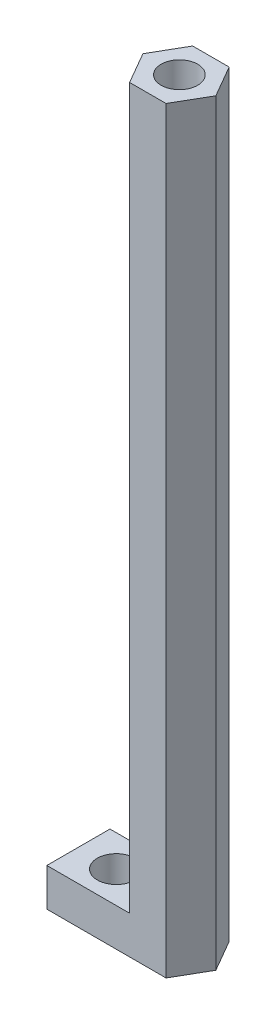
from build123d import *

# Parameters (mm, degrees)
SKETCH2_R           = 1.5
BOSS_EXTRUDE1_DEPTH = 3
BOSS_EXTRUDE2_DEPTH = 60
SKETCH3_R           = 1.45
CUT_EXTRUDE1_DEPTH  = 10
CUT_EXTRUDE2_DEPTH  = 8
SKETCH5_R           = 2.5
CUT_EXTRUDE3_DEPTH  = 3
CHAMFER1_SIZE       = 1


with BuildPart() as part:
    # Sketch2 → Boss-Extrude1 (new body)
    # profile 1 of 3: a face of its own
    with BuildSketch(Plane(origin=(0, 0, 0), x_dir=(1, 0, 0), z_dir=(0, 1, 0))):
        Polygon((2.113248654, 0), (3.556624327, 2.5), (-3, 2.5), (-3, -2.5), (3.556624327, -2.5), align=None)
        with Locations(Location((0, 0, 0), (0, 0, 270))):
            Circle(SKETCH2_R, mode=Mode.SUBTRACT)
    # profile 2 of 3: a face of its own
    with BuildSketch(Plane(origin=(0, 0, 0), x_dir=(1, 0, 0), z_dir=(0, 1, 0))):
        Polygon((8, -2.5), (8, 2.5), (6.443375673, 2.5), (7.886751346, 0), (6.443375673, -2.5), align=None)
    # profile 3 of 3: a face of its own
    with BuildSketch(Plane(origin=(0, 0, 0), x_dir=(1, 0, 0), z_dir=(0, 1, 0))):
        Polygon((7.886751346, 0), (6.443375673, 2.5), (3.556624327, 2.5), (2.113248654, 0), (3.556624327, -2.5), (6.443375673, -2.5), align=None)
    extrude(amount=BOSS_EXTRUDE1_DEPTH)

    # Sketch2<3> → Boss-Extrude2 (add)
    with BuildSketch(Plane(origin=(0, 0, 0), x_dir=(1, 0, 0), z_dir=(0, 1, 0))):
        Polygon((3.556624327, 2.5), (2.113248654, 0), (3.556624327, -2.5), (6.443375673, -2.5), (7.886751346, 0), (6.443375673, 2.5), align=None)
    extrude(amount=BOSS_EXTRUDE2_DEPTH)

    # Sketch3 → Cut-Extrude1 (cut)
    with BuildSketch(Plane(origin=(0, 60, 0), x_dir=(1, 0, 0), z_dir=(0, 1, 0))):
        with Locations(Location((5, 0, 0), (0, 0, 270))):
            Circle(SKETCH3_R)
    extrude(amount=-CUT_EXTRUDE1_DEPTH, mode=Mode.SUBTRACT)

    # Sketch4 → Cut-Extrude2 (cut)
    with BuildSketch(Plane(origin=(0, 3, 0), x_dir=(1, 0, 0), z_dir=(0, 1, 0))):
        Polygon((6.443375673, 2.5), (8, 2.5), (8, -2.5), (6.443375673, -2.5), (7.886751346, 0), align=None)
    extrude(amount=-CUT_EXTRUDE2_DEPTH, mode=Mode.SUBTRACT)

    # Sketch5 → Cut-Extrude3 (cut)
    with BuildSketch(Plane(origin=(0, 3, 0), x_dir=(1, 0, 0), z_dir=(0, 1, 0))):
        Circle(SKETCH5_R)
    extrude(amount=CUT_EXTRUDE3_DEPTH, mode=Mode.SUBTRACT)

    # Chamfer1
    # the kernel refuses this chamfer: 1 mm, written as the material it takes off along each edge
    with BuildSketch(Plane(origin=(0.82740716, 6, -2.227142798), x_dir=(0.8656979742248804, -0.027495876610586487, -0.49981095845564805), z_dir=(0.4999999999999997, 0, 0.8660254037844388))) as chamfer1_piece_1_section:
        Polygon((CHAMFER1_SIZE * 0.999621916911, CHAMFER1_SIZE * 0.0274958766106), (-CHAMFER1_SIZE * 0.0274958766106, CHAMFER1_SIZE * 0.999621916911), (0, 0), align=None)
    chamfer1_piece_1 = extrude(amount=5.789866745, mode=Mode.PRIVATE)
    chamfer1_piece_1 = chamfer1_piece_1 & Plane(origin=(0, 6.406914482, 0), x_dir=(1, 0, 0), z_dir=(0, -1, 0)) * Cylinder(2.5, 16, mode=Mode.PRIVATE)
    add(chamfer1_piece_1, mode=Mode.SUBTRACT)
    with BuildSketch(Plane(origin=(3.722340533, 6, -2.787028888), x_dir=(0.8656979742248803, -0.027495876610586504, 0.4998109584556485), z_dir=(-0.5000000000000001, 0, 0.8660254037844386))) as chamfer1_piece_2_section:
        Polygon((CHAMFER1_SIZE * 0.999621916911, CHAMFER1_SIZE * 0.0274958766106), (-CHAMFER1_SIZE * 0.0274958766106, CHAMFER1_SIZE * 0.999621916911), (0, 0), align=None)
    chamfer1_piece_2 = extrude(amount=5.789866745, mode=Mode.PRIVATE)
    chamfer1_piece_2 = chamfer1_piece_2 & Plane(origin=(0, 6.406914482, 0), x_dir=(1, 0, 0), z_dir=(0, -1, 0)) * Cylinder(2.5, 16, mode=Mode.PRIVATE)
    add(chamfer1_piece_2, mode=Mode.SUBTRACT)


solid = part.part
